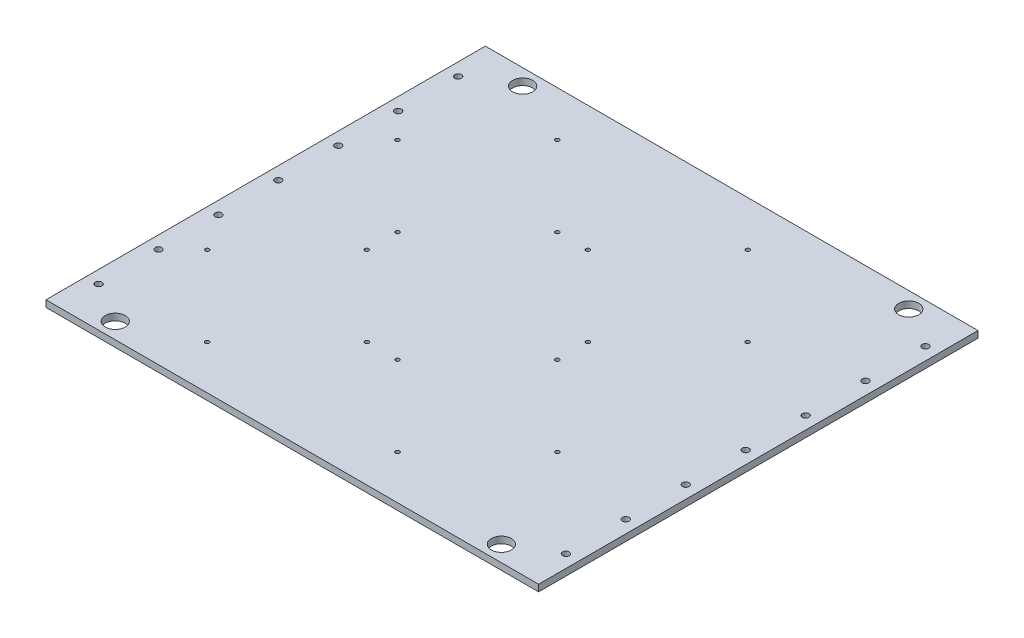
from build123d import *

# Parameters (mm, degrees)
SKETCH_1_W          = 370
SKETCH_1_H          = 330
EXTRUDE_1_DEPTH     = 5
SKETCH_3_W          = 220
SKETCH_3_H          = 20
CUT_EXTRUDE_2_DEPTH = 248.941525364
SKETCH_9_W          = 239.54111937
SKETCH_9_H          = 233.56752537
EXTRUDE_2_DEPTH     = 5
SKETCH_12_R         = 2.5
CUT_EXTRUDE_6_DEPTH = 10
SKETCH_13_R         = 7.5
CUT_EXTRUDE_7_DEPTH = 10
SKETCH_14_R         = 1.5
CUT_EXTRUDE_8_DEPTH = 10


with BuildPart() as part:
    # 草图1 → 凸台-拉伸1 (new body)
    with BuildSketch(Plane(origin=(0, 0, 0), x_dir=(1, 0, 0), z_dir=(0, 1, 0))):
        Rectangle(SKETCH_1_W, SKETCH_1_H)
    extrude(amount=EXTRUDE_1_DEPTH)

    # 草图3 → 切除-拉伸2 (cut, through all)
    with BuildSketch(Plane(origin=(0, 5, 0), x_dir=(1, 0, 0), z_dir=(0, 1, 0))):
        with Locations((0, 50)):
            Rectangle(SKETCH_3_W, SKETCH_3_H)
        with Locations((0, 100)):
            Rectangle(SKETCH_3_W, SKETCH_3_H)
        Rectangle(SKETCH_3_W, SKETCH_3_H)
        with Locations((0, -50)):
            Rectangle(SKETCH_3_W, SKETCH_3_H)
        with Locations((0, -100)):
            Rectangle(SKETCH_3_W, SKETCH_3_H)
    extrude(amount=-CUT_EXTRUDE_2_DEPTH, mode=Mode.SUBTRACT)

    # 草图9 → 凸台-拉伸2 (add)
    with BuildSketch(Plane(origin=(0, 5, 0), x_dir=(1, 0, 0), z_dir=(0, 1, 0))):
        with Locations((2.0907579, 0.2986797)):
            Rectangle(SKETCH_9_W, SKETCH_9_H)
    extrude(amount=-EXTRUDE_2_DEPTH)

    # 草图12 → 切除-拉伸6 (cut)
    with BuildSketch(Plane(origin=(0, 5, 0), x_dir=(1, 0, 0), z_dir=(0, 1, 0))):
        with Locations((175.5, 0)):
            Circle(SKETCH_12_R)
        with Locations((175.5, 45)):
            Circle(SKETCH_12_R)
        with Locations((175.5, 90)):
            Circle(SKETCH_12_R)
        with Locations((175.5, 135)):
            Circle(SKETCH_12_R)
        with Locations((175.5, -135)):
            Circle(SKETCH_12_R)
        with Locations((175.5, -90)):
            Circle(SKETCH_12_R)
        with Locations((175.5, -45)):
            Circle(SKETCH_12_R)
        with Locations((-175.5, -45)):
            Circle(SKETCH_12_R)
        with Locations((-175.5, -90)):
            Circle(SKETCH_12_R)
        with Locations((-175.5, -135)):
            Circle(SKETCH_12_R)
        with Locations((-175.5, 135)):
            Circle(SKETCH_12_R)
        with Locations((-175.5, 90)):
            Circle(SKETCH_12_R)
        with Locations((-175.5, 45)):
            Circle(SKETCH_12_R)
        with Locations((-175.5, 0)):
            Circle(SKETCH_12_R)
    extrude(amount=-CUT_EXTRUDE_6_DEPTH, mode=Mode.SUBTRACT)

    # 草图13 → 切除-拉伸7 (cut)
    with BuildSketch(Plane(origin=(0, 5, 0), x_dir=(1, 0, 0), z_dir=(0, 1, 0))):
        with Locations((-145, -153)):
            Circle(SKETCH_13_R)
        with Locations((145, -153)):
            Circle(SKETCH_13_R)
        with Locations((145, 153)):
            Circle(SKETCH_13_R)
        with Locations((-145, 153)):
            Circle(SKETCH_13_R)
    extrude(amount=-CUT_EXTRUDE_7_DEPTH, mode=Mode.SUBTRACT)

    # 草图14 → 切除-拉伸8 (cut)
    with BuildSketch(Plane(origin=(0, 5, 0), x_dir=(1, 0, 0), z_dir=(0, 1, 0))):
        with Locations((-97, 131)):
            Circle(SKETCH_14_R)
        with Locations((-157, 71)):
            Circle(SKETCH_14_R)
        with Locations((-37, 71)):
            Circle(SKETCH_14_R)
        with Locations((-97, 11)):
            Circle(SKETCH_14_R)
        with Locations((-97, -12)):
            Circle(SKETCH_14_R)
        with Locations((-157, -72)):
            Circle(SKETCH_14_R)
        with Locations((-97, -132)):
            Circle(SKETCH_14_R)
        with Locations((-37, -72)):
            Circle(SKETCH_14_R)
        with Locations((-14, -72)):
            Circle(SKETCH_14_R)
        with Locations((46, -132)):
            Circle(SKETCH_14_R)
        with Locations((106, -72)):
            Circle(SKETCH_14_R)
        with Locations((46, -12)):
            Circle(SKETCH_14_R)
        with Locations((46, 11)):
            Circle(SKETCH_14_R)
        with Locations((-14, 71)):
            Circle(SKETCH_14_R)
        with Locations((106, 71)):
            Circle(SKETCH_14_R)
        with Locations((46, 131)):
            Circle(SKETCH_14_R)
    extrude(amount=-CUT_EXTRUDE_8_DEPTH, mode=Mode.SUBTRACT)


solid = part.part
